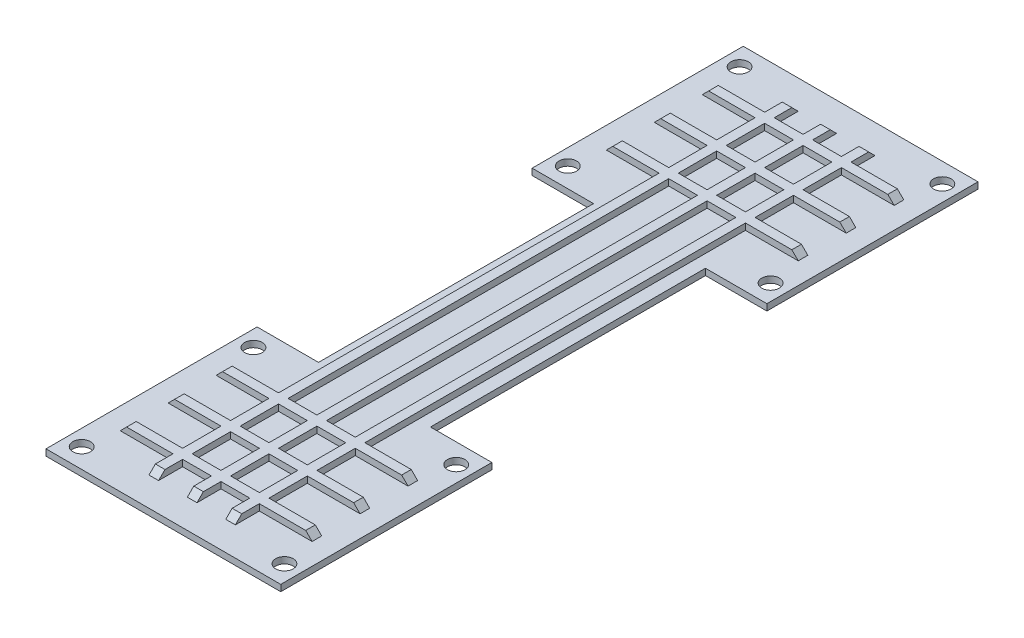
from build123d import *

# Parameters (mm, degrees)
SKETCH1_R                = 2.75
BOSS_EXTRUDE1_DEPTH      = 2
SKETCH2_W                = 3
SKETCH2_H                = 100
BOSS_EXTRUDE2_DEPTH      = 2
SKETCH3_W                = 60
SKETCH3_H                = 3
BOSS_EXTRUDE3_DEPTH      = 2
CHAMFER1_SIZE            = 2
CHAMFER1_OF_MIRROR1_SIZE = 2


with BuildPart() as part:
    # Sketch1 → Boss-Extrude1 (new body)
    with BuildSketch(Plane(origin=(0, 0, 0), x_dir=(1, 0, 0), z_dir=(0, 1, 0))):
        Polygon((-17.5, 42.995), (-17.5, -42.995), (-36.7, -42.995), (-36.7, -109.005), (36.7, -109.005), (36.7, -42.995), (17.5, -42.995), (17.5, 42.995), (36.7, 42.995), (36.7, 109.005), (-36.7, 109.005), (-36.7, 42.995), align=None)
        with Locations(Location((-31.7, 102.855, 0), (0, 0, 270))):
            Circle(SKETCH1_R, mode=Mode.SUBTRACT)
        with Locations(Location((-31.7, 49.145, 0), (0, 0, 270))):
            Circle(SKETCH1_R, mode=Mode.SUBTRACT)
        with Locations(Location((31.7, 49.145, 0), (0, 0, 270))):
            Circle(SKETCH1_R, mode=Mode.SUBTRACT)
        with Locations(Location((31.7, 102.855, 0), (0, 0, 270))):
            Circle(SKETCH1_R, mode=Mode.SUBTRACT)
        with Locations(Location((31.7, -102.855, 0), (0, 0, 270))):
            Circle(SKETCH1_R, mode=Mode.SUBTRACT)
        with Locations(Location((31.7, -49.145, 0), (0, 0, 270))):
            Circle(SKETCH1_R, mode=Mode.SUBTRACT)
        with Locations(Location((-31.7, -49.145, 0), (0, 0, 270))):
            Circle(SKETCH1_R, mode=Mode.SUBTRACT)
        with Locations(Location((-31.7, -102.855, 0), (0, 0, 270))):
            Circle(SKETCH1_R, mode=Mode.SUBTRACT)
    extrude(amount=BOSS_EXTRUDE1_DEPTH)

    # Sketch2 → Boss-Extrude2 (add)
    with BuildSketch(Plane(origin=(0, 2, 0), x_dir=(1, 0, 0), z_dir=(0, 1, 0))):
        with Locations((12, -50)):
            Rectangle(SKETCH2_W, SKETCH2_H)
        with Locations((0, -50)):
            Rectangle(SKETCH2_W, SKETCH2_H)
        with Locations((-12, -50)):
            Rectangle(SKETCH2_W, SKETCH2_H)
    boss_extrude2 = extrude(amount=BOSS_EXTRUDE2_DEPTH)

    # Sketch3 → Boss-Extrude3 (add)
    with BuildSketch(Plane(origin=(0, 2, 0), x_dir=(1, 0, 0), z_dir=(0, 1, 0))):
        with Locations((0, -91)):
            Rectangle(SKETCH3_W, SKETCH3_H)
        with Locations((0, -61)):
            Rectangle(SKETCH3_W, SKETCH3_H)
        with Locations((0, -76)):
            Rectangle(SKETCH3_W, SKETCH3_H)
    boss_extrude3 = extrude(amount=BOSS_EXTRUDE3_DEPTH)

    # Chamfer1
    chamfer1_edges = [part.edges().sort_by_distance(p)[0] for p in [
        (30, 4, 61),
        (30, 4, 76),
        (30, 4, 91),
        (12, 4, 100),
        (0, 4, 100),
        (-12, 4, 100),
        (-30, 4, 91),
        (-30, 4, 76),
        (-30, 4, 61),
    ]]
    chamfer(chamfer1_edges, length=CHAMFER1_SIZE - 0.0001)  # a hair under: the kernel refuses the full size

    # Mirror1: Boss-Extrude2, Boss-Extrude3 across plane
    add(boss_extrude2.mirror(Plane.XY))
    add(boss_extrude3.mirror(Plane.XY))

    # Chamfer1 of Mirror1
    chamfer1_of_mirror1_edges = [part.edges().sort_by_distance(p)[0] for p in [
        (30, 4, -61),
        (30, 4, -76),
        (30, 4, -91),
        (12, 4, -100),
        (0, 4, -100),
        (-12, 4, -100),
        (-30, 4, -91),
        (-30, 4, -76),
        (-30, 4, -61),
    ]]
    chamfer(chamfer1_of_mirror1_edges, length=CHAMFER1_OF_MIRROR1_SIZE - 0.0001)  # a hair under: the kernel refuses the full size


solid = part.part
